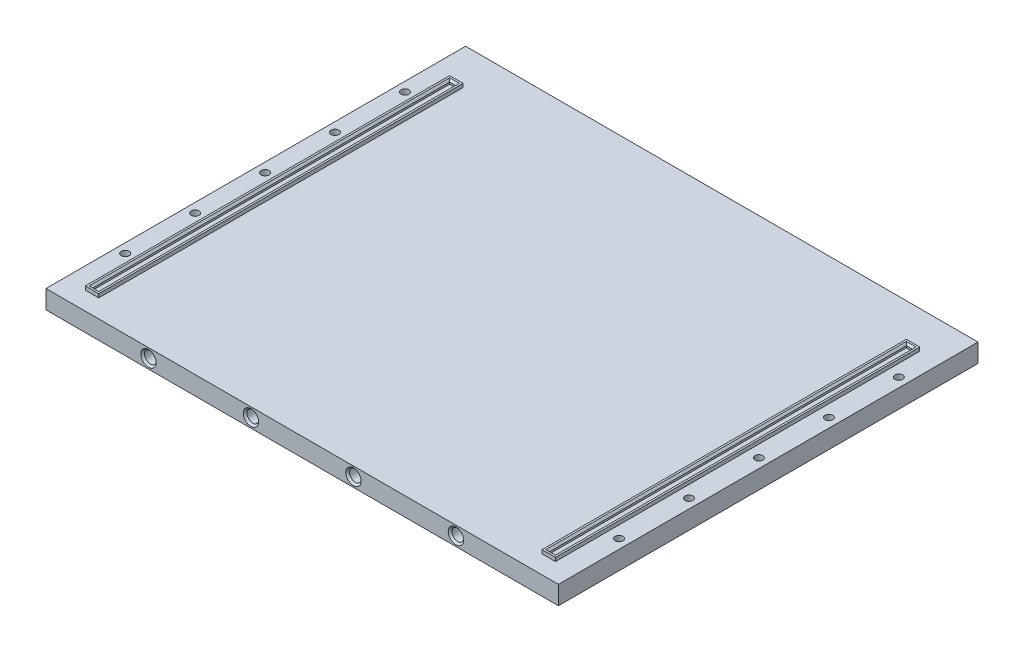
from build123d import *

# Parameters (mm, degrees)
SKETCH_1_W             = 138
SKETCH_1_H             = 113
EXTRUDE_298_DEPTH      = 5
SKETCH_2_W             = 3.6
SKETCH_2_H             = 98.1
SKETCH_2_W_2           = 1.6
SKETCH_2_H_2           = 96.1
EXTRUDE_2281_DEPTH     = 1
CHAMFER_2336_SIZE      = 0.5
CHAMFER_2524_SIZE      = 0.5
SKETCH_3_R             = 1.575
CUT_EXTRUDE_2955_DEPTH = 4.2
CUT_EXTRUDE_3490_REACH = 91.383
SKETCH_4_R             = 1.05
SKETCH_5_R             = 2
CUT_EXTRUDE_4000_DEPTH = 3
CHAMFER_4045_SIZE      = 0.5


with BuildPart() as part:
    # Эскиз1 → Extrude 298 (new body)
    with BuildSketch(Plane(origin=(0, 0, 0), x_dir=(1, 0, 0), z_dir=(0, 1, 0))):
        Rectangle(SKETCH_1_W, SKETCH_1_H)
    extrude(amount=EXTRUDE_298_DEPTH)

    # Эскиз2 → Extrude 2281 (add)
    # profile 1 of 2: a face of its own
    with BuildSketch(Plane(origin=(0, 5, 0), x_dir=(1, 0, 0), z_dir=(0, 1, 0))):
        with Locations((-61.5, -2.55)):
            Rectangle(SKETCH_2_W, SKETCH_2_H)
        with Locations((-61.5, -2.55)):
            Rectangle(SKETCH_2_W_2, SKETCH_2_H_2, mode=Mode.SUBTRACT)
    # profile 2 of 2: a face of its own
    with BuildSketch(Plane(origin=(0, 5, 0), x_dir=(1, 0, 0), z_dir=(0, 1, 0))):
        with Locations((61.5, -2.55)):
            Rectangle(SKETCH_2_W, SKETCH_2_H)
        with Locations((61.5, -2.55)):
            Rectangle(SKETCH_2_W_2, SKETCH_2_H_2, mode=Mode.SUBTRACT)
    extrude(amount=EXTRUDE_2281_DEPTH)

    # Chamfer 2336
    chamfer_2336_edges = [part.edges().sort_by_distance(p)[0] for p in [
        (-61.5, 6, -45.5),
        (-60.7, 6, 2.55),
        (-61.5, 6, 50.6),
        (-62.3, 6, 2.55),
    ]]
    chamfer(chamfer_2336_edges, length=CHAMFER_2336_SIZE)

    # Chamfer 2524
    chamfer_2524_edges = [part.edges().sort_by_distance(p)[0] for p in [
        (61.5, 6, 50.6),
        (60.7, 6, 2.55),
        (61.5, 6, -45.5),
        (62.3, 6, 2.55),
    ]]
    chamfer(chamfer_2524_edges, length=CHAMFER_2524_SIZE)

    # Эскиз3 → Cut-Extrude 2955 (cut)
    with BuildSketch(Plane(origin=(0, 0, -56.5), x_dir=(-1, 0, 0), z_dir=(0, 0, -1))):
        with Locations((-41.4, 2.5)):
            Circle(SKETCH_3_R)
        with Locations((-13.8, 2.5)):
            Circle(SKETCH_3_R)
        with Locations((13.8, 2.5)):
            Circle(SKETCH_3_R)
        with Locations((41.4, 2.5)):
            Circle(SKETCH_3_R)
    cut_extrude_2955 = extrude(amount=-CUT_EXTRUDE_2955_DEPTH, mode=Mode.SUBTRACT)

    # Зеркальное отражение1: Cut-Extrude 2955 across plane
    add(cut_extrude_2955.mirror(Plane(origin=(0, 0, 0), x_dir=(1, 0, 0), z_dir=(0, 0, -1))), mode=Mode.SUBTRACT)

    # Эскиз4 → Cut-Extrude 3490 (cut, up to next)
    with BuildSketch(Plane.XZ, mode=Mode.PRIVATE) as cut_extrude_3490_sk1:
        with Locations((-66.5, 37.666666667)):
            Circle(SKETCH_4_R)
    cut_extrude_3490_tool1 = extrude(cut_extrude_3490_sk1.sketch, amount=-CUT_EXTRUDE_3490_REACH, mode=Mode.PRIVATE) & part.part
    # Эскиз4 → Cut-Extrude 3490 (cut, up to next)
    with BuildSketch(Plane.XZ, mode=Mode.PRIVATE) as cut_extrude_3490_sk2:
        with Locations((-66.5, 18.833333333)):
            Circle(SKETCH_4_R)
    cut_extrude_3490_tool2 = extrude(cut_extrude_3490_sk2.sketch, amount=-CUT_EXTRUDE_3490_REACH, mode=Mode.PRIVATE) & part.part
    # Эскиз4 → Cut-Extrude 3490 (cut, up to next)
    with BuildSketch(Plane.XZ, mode=Mode.PRIVATE) as cut_extrude_3490_sk3:
        with Locations((-66.5, 0)):
            Circle(SKETCH_4_R)
    cut_extrude_3490_tool3 = extrude(cut_extrude_3490_sk3.sketch, amount=-CUT_EXTRUDE_3490_REACH, mode=Mode.PRIVATE) & part.part
    # Эскиз4 → Cut-Extrude 3490 (cut, up to next)
    with BuildSketch(Plane.XZ, mode=Mode.PRIVATE) as cut_extrude_3490_sk4:
        with Locations((-66.5, -18.833333333)):
            Circle(SKETCH_4_R)
    cut_extrude_3490_tool4 = extrude(cut_extrude_3490_sk4.sketch, amount=-CUT_EXTRUDE_3490_REACH, mode=Mode.PRIVATE) & part.part
    # Эскиз4 → Cut-Extrude 3490 (cut, up to next)
    with BuildSketch(Plane.XZ, mode=Mode.PRIVATE) as cut_extrude_3490_sk5:
        with Locations((-66.5, -37.666666667)):
            Circle(SKETCH_4_R)
    cut_extrude_3490_tool5 = extrude(cut_extrude_3490_sk5.sketch, amount=-CUT_EXTRUDE_3490_REACH, mode=Mode.PRIVATE) & part.part
    # Эскиз4 → Cut-Extrude 3490 (cut, up to next)
    with BuildSketch(Plane.XZ, mode=Mode.PRIVATE) as cut_extrude_3490_sk6:
        with Locations((66.5, -37.666666667)):
            Circle(SKETCH_4_R)
    cut_extrude_3490_tool6 = extrude(cut_extrude_3490_sk6.sketch, amount=-CUT_EXTRUDE_3490_REACH, mode=Mode.PRIVATE) & part.part
    # Эскиз4 → Cut-Extrude 3490 (cut, up to next)
    with BuildSketch(Plane.XZ, mode=Mode.PRIVATE) as cut_extrude_3490_sk7:
        with Locations((66.5, -18.833333333)):
            Circle(SKETCH_4_R)
    cut_extrude_3490_tool7 = extrude(cut_extrude_3490_sk7.sketch, amount=-CUT_EXTRUDE_3490_REACH, mode=Mode.PRIVATE) & part.part
    # Эскиз4 → Cut-Extrude 3490 (cut, up to next)
    with BuildSketch(Plane.XZ, mode=Mode.PRIVATE) as cut_extrude_3490_sk8:
        with Locations((66.5, 0)):
            Circle(SKETCH_4_R)
    cut_extrude_3490_tool8 = extrude(cut_extrude_3490_sk8.sketch, amount=-CUT_EXTRUDE_3490_REACH, mode=Mode.PRIVATE) & part.part
    # Эскиз4 → Cut-Extrude 3490 (cut, up to next)
    with BuildSketch(Plane.XZ, mode=Mode.PRIVATE) as cut_extrude_3490_sk9:
        with Locations((66.5, 18.833333333)):
            Circle(SKETCH_4_R)
    cut_extrude_3490_tool9 = extrude(cut_extrude_3490_sk9.sketch, amount=-CUT_EXTRUDE_3490_REACH, mode=Mode.PRIVATE) & part.part
    # Эскиз4 → Cut-Extrude 3490 (cut, up to next)
    with BuildSketch(Plane.XZ, mode=Mode.PRIVATE) as cut_extrude_3490_sk10:
        with Locations((66.5, 37.666666667)):
            Circle(SKETCH_4_R)
    cut_extrude_3490_tool10 = extrude(cut_extrude_3490_sk10.sketch, amount=-CUT_EXTRUDE_3490_REACH, mode=Mode.PRIVATE) & part.part
    add(cut_extrude_3490_tool1.solids().sort_by_distance((-66.5, 0, 37.666667))[0], mode=Mode.SUBTRACT)
    add(cut_extrude_3490_tool2.solids().sort_by_distance((-66.5, 0, 18.833333))[0], mode=Mode.SUBTRACT)
    add(cut_extrude_3490_tool3.solids().sort_by_distance((-66.5, 0, 0))[0], mode=Mode.SUBTRACT)
    add(cut_extrude_3490_tool4.solids().sort_by_distance((-66.5, 0, -18.833333))[0], mode=Mode.SUBTRACT)
    add(cut_extrude_3490_tool5.solids().sort_by_distance((-66.5, 0, -37.666667))[0], mode=Mode.SUBTRACT)
    add(cut_extrude_3490_tool6.solids().sort_by_distance((66.5, 0, -37.666667))[0], mode=Mode.SUBTRACT)
    add(cut_extrude_3490_tool7.solids().sort_by_distance((66.5, 0, -18.833333))[0], mode=Mode.SUBTRACT)
    add(cut_extrude_3490_tool8.solids().sort_by_distance((66.5, 0, 0))[0], mode=Mode.SUBTRACT)
    add(cut_extrude_3490_tool9.solids().sort_by_distance((66.5, 0, 18.833333))[0], mode=Mode.SUBTRACT)
    add(cut_extrude_3490_tool10.solids().sort_by_distance((66.5, 0, 37.666667))[0], mode=Mode.SUBTRACT)

    # Эскиз5 → Cut-Extrude 4000 (cut)
    with BuildSketch(Plane.XZ):
        with Locations((-66.5, 37.666666667)):
            Circle(SKETCH_5_R)
        with Locations((-66.5, 18.833333333)):
            Circle(SKETCH_5_R)
        with Locations((-66.5, 0)):
            Circle(SKETCH_5_R)
        with Locations((-66.5, -18.833333333)):
            Circle(SKETCH_5_R)
        with Locations((-66.5, -37.666666667)):
            Circle(SKETCH_5_R)
        with Locations((66.5, -37.666666667)):
            Circle(SKETCH_5_R)
        with Locations((66.5, -18.833333333)):
            Circle(SKETCH_5_R)
        with Locations((66.5, 0)):
            Circle(SKETCH_5_R)
        with Locations((66.5, 18.833333333)):
            Circle(SKETCH_5_R)
        with Locations((66.5, 37.666666667)):
            Circle(SKETCH_5_R)
    extrude(amount=-CUT_EXTRUDE_4000_DEPTH, mode=Mode.SUBTRACT)

    # Chamfer 4045
    chamfer_4045_edges = [part.edges().sort_by_distance(p)[0] for p in [
        (42.975, 2.5, 56.5),
        (15.375, 2.5, 56.5),
        (-12.225, 2.5, 56.5),
        (-39.825, 2.5, 56.5),
        (-39.825, 2.5, -56.5),
        (-12.225, 2.5, -56.5),
        (15.375, 2.5, -56.5),
        (42.975, 2.5, -56.5),
    ]]
    chamfer(chamfer_4045_edges, length=CHAMFER_4045_SIZE)


solid = part.part
